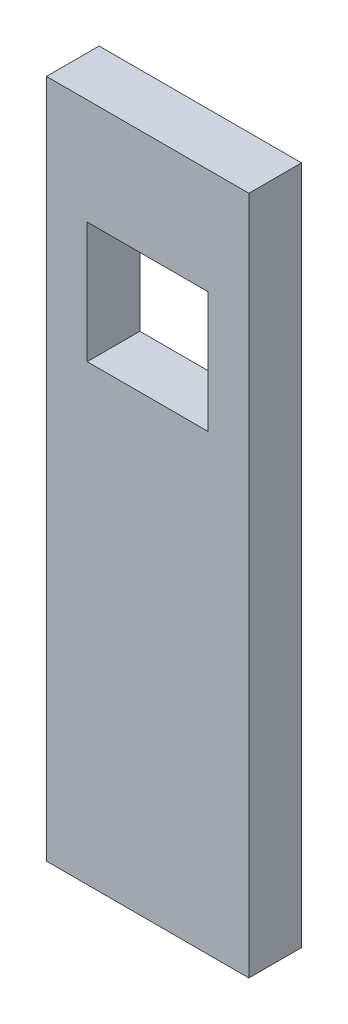
from build123d import *

# Parameters (mm, degrees)
SKETCH1_W           = 11.95
SKETCH1_H           = 11.95
BOSS_EXTRUDE1_DEPTH = 2.6


with BuildPart() as part:
    # Sketch1 → Boss-Extrude1 (new, symmetric)
    with BuildSketch(Plane.XY):
        Polygon((0, 67.15), (0, 44.75), (0, 39.55), (0, 27.6), (0, 22.4), (0, 0), (20, 0), (20, 22.4), (20, 27.6), (20, 39.55), (20, 44.75), (20, 67.15), align=None)
        with Locations((10, 50.725)):
            Rectangle(SKETCH1_W, SKETCH1_H, mode=Mode.SUBTRACT)
    extrude(amount=BOSS_EXTRUDE1_DEPTH, both=True)


solid = part.part
